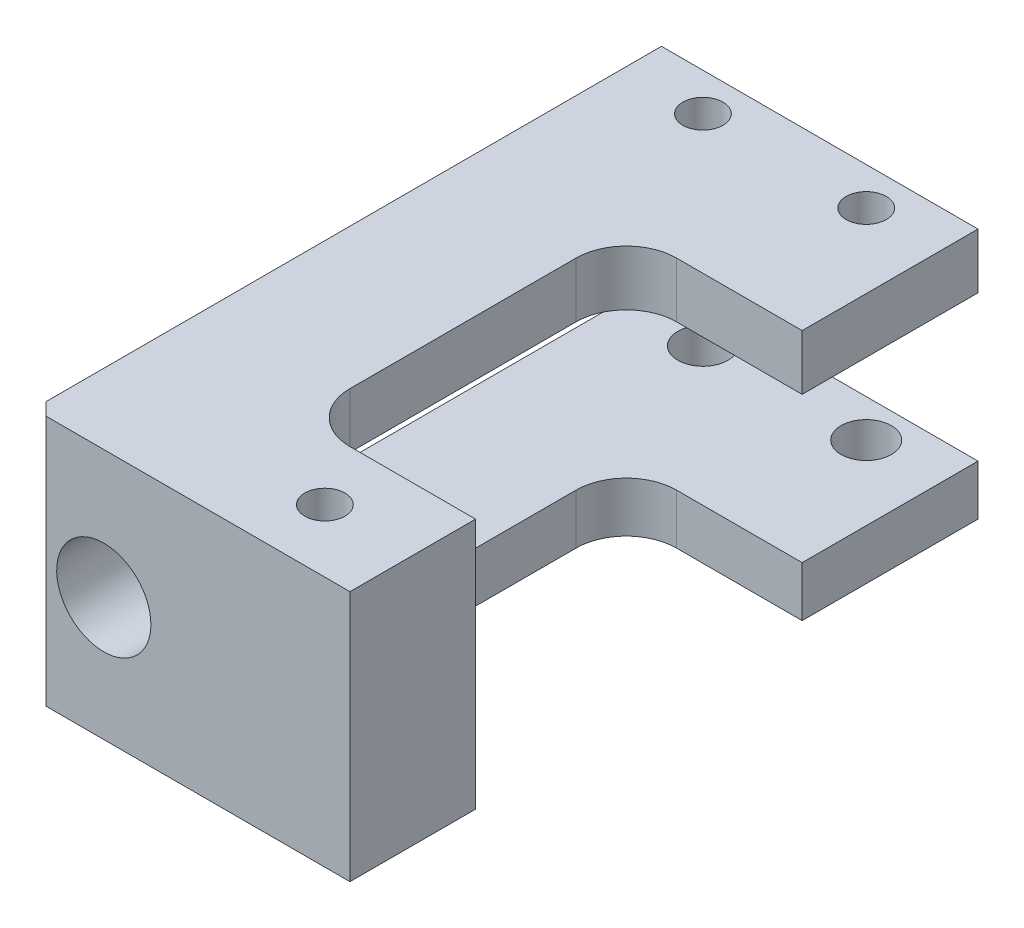
from build123d import *

# Parameters (mm, degrees)
SKETCH1_W                   = 12.6
SKETCH1_H                   = 25
BOSS_EXTRUDE1_DEPTH         = 10
CUT_EXTRUDE9_START          = -5
SKETCH14_W                  = 7
SKETCH14_H                  = 5.8
CUT_EXTRUDE9_DEPTH          = 20
SKETCH15_W                  = 20
SKETCH15_H                  = 5.8
CUT_EXTRUDE10_DEPTH         = 18.47140521
CUT_EXTRUDE11_DEPTH         = 17.122654868
CUT_EXTRUDE11_DEPTH_BACK    = 17.122654868
SKETCH17_W                  = 7
SKETCH17_H                  = 13
SKETCH18_R                  = 1.875
CUT_EXTRUDE12_DEPTH         = 24.231228982
FILLET2_R                   = 2
SKETCH20_R                  = 1
CUT_EXTRUDE18_DEPTH         = 5
TAP_DRILL_FOR_M2X0_4_TAP2_D = 1.6
TAP_DRILL_FOR_M2X0_4_TAP3_D = 1.6
FILLET4_R                   = 0.2
CHAMFER1_SIZE               = 0.5


with BuildPart() as part:
    # Sketch1 → Boss-Extrude1 (new body)
    with BuildSketch(Plane(origin=(0, 0, 0), x_dir=(1, 0, 0), z_dir=(0, 1, 0))):
        Rectangle(SKETCH1_W, SKETCH1_H)
    extrude(amount=BOSS_EXTRUDE1_DEPTH)

    # Sketch14 → Cut-Extrude9 (cut)
    with BuildSketch(Plane.XY.offset(12.5).offset(CUT_EXTRUDE9_START)):
        with Locations((2.8, 4.9)):
            Rectangle(SKETCH14_W, SKETCH14_H)
    extrude(amount=-CUT_EXTRUDE9_DEPTH, mode=Mode.SUBTRACT)

    # Sketch15 → Cut-Extrude10 (cut, through all)
    with BuildSketch(Plane(origin=(-0.7, 0, 0), x_dir=(0, 0, -1), z_dir=(1, 0, 0))):
        with Locations((2.5, 4.9)):
            Rectangle(SKETCH15_W, SKETCH15_H)
    extrude(amount=-CUT_EXTRUDE10_DEPTH, mode=Mode.SUBTRACT)

    # Sketch17 → Cut-Extrude11 (cut, two sides: drawn at the far end of the back side and taken through both)
    with BuildSketch(Plane(origin=(0, 2, 0), x_dir=(1, 0, 0), z_dir=(0, 1, 0)).offset(-CUT_EXTRUDE11_DEPTH_BACK)):
        with Locations((2.8, -1)):
            Rectangle(SKETCH17_W, SKETCH17_H)
    extrude(amount=CUT_EXTRUDE11_DEPTH + CUT_EXTRUDE11_DEPTH_BACK, mode=Mode.SUBTRACT)

    # Sketch18 → Cut-Extrude12 (cut, through all)
    with BuildSketch(Plane(origin=(0, 0, 7.5), x_dir=(-1, 0, 0), z_dir=(0, 0, -1))):
        with Locations((3.5, 4.9)):
            Circle(SKETCH18_R)
    extrude(amount=-CUT_EXTRUDE12_DEPTH, mode=Mode.SUBTRACT)

    # Fillet2
    fillet2_edges = [part.edges().sort_by_distance(p)[0] for p in [
        (-0.7, 8.9, -5.5),
        (-0.7, 1, -5.5),
        (-0.7, 1, 7.5),
        (-0.7, 8.9, 7.5),
    ]]
    fillet(fillet2_edges, radius=FILLET2_R)

    # Sketch20 → Cut-Extrude18 (cut)
    with BuildSketch(Plane.XZ):
        with Locations((3.35, -11)):
            Circle(SKETCH20_R)
        with Locations((-3.15, -11)):
            Circle(SKETCH20_R)
    extrude(amount=-CUT_EXTRUDE18_DEPTH, mode=Mode.SUBTRACT)

    # Tap Drill for M2x0.4 Tap2 (through all)
    with Locations(Plane(origin=(3.35, 10, -11), x_dir=(0, 0, 1), z_dir=(0, 1, 0))):
        with Locations((0, 0), (0, -6.5)):
            Hole(TAP_DRILL_FOR_M2X0_4_TAP2_D / 2)

    # Tap Drill for M2x0.4 Tap3 (through all)
    with Locations(Plane(origin=(2.8, 10, 10), x_dir=(0, 0, 1), z_dir=(0, 1, 0))):
        with Locations((0, 0)):
            Hole(TAP_DRILL_FOR_M2X0_4_TAP3_D / 2)

    # Fillet4
    fillet4_edges = [part.edges().sort_by_distance(p)[0] for p in [
        (-2.5, 7.8, 7.5),
        (-2.5, 2, 7.5),
    ]]
    fillet(fillet4_edges, radius=FILLET4_R)

    # Chamfer1
    chamfer1_edges = [part.edges().sort_by_distance(p)[0] for p in [
        (-6.3, 5, 12.5),
    ]]
    chamfer(chamfer1_edges, length=CHAMFER1_SIZE)


solid = part.part
